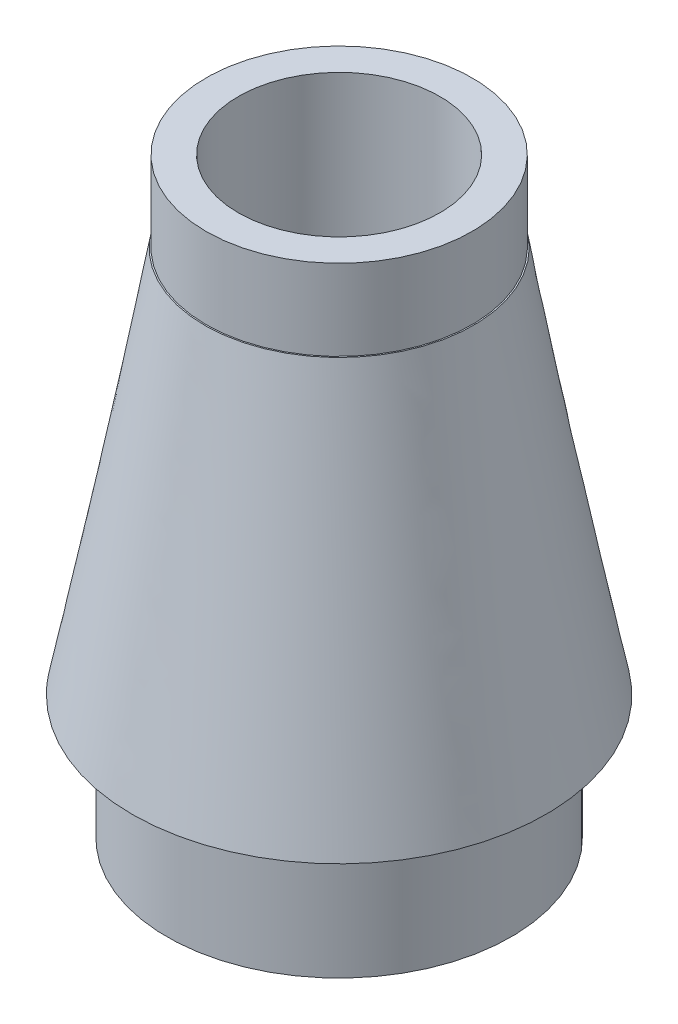
from build123d import *

# Parameters (mm, degrees)
BOSS_EXTRUDE1_REACH = 12.263
SKETCH4_R           = 2.475
BOSS_EXTRUDE2_REACH = 14.274
SKETCH1_R           = 3.2
CUT_EXTRUDE1_START  = -4
SKETCH5_R           = 2.475
CUT_EXTRUDE1_DEPTH  = 4
CUT_EXTRUDE2_REACH  = 14.274
SKETCH6_R           = 1.875


with BuildPart() as part:
    # Loft4: read off the stored shape, not the designer's step
    # Loft4: loft between two sections, ruled curve by curve
    loft4_from = [
        Edge.make_bspline([(3.50290491, 2.3, -1.597547242), (0.307810426, 2.3, -8.603357062), (-6.697999394, 2.3, -5.408262578), (-3.50290491, 2.3, 1.597547242), (-0.307810426, 2.3, 8.603357062), (6.697999394, 2.3, 5.408262578), (3.50290491, 2.3, -1.597547242)], [0, 0, 0, 0, 0.5, 0.5, 0.5, 1, 1, 1, 1], 3, [1, 0.333333333, 0.333333333, 1, 0.333333333, 0.333333333, 1]),
    ]
    loft4_to = [
        Edge.make_bspline([(2.465425341, 9.5, -0.414340307), (1.636744726, 9.5, -5.345190988), (-3.294105955, 9.5, -4.516510374), (-2.465425341, 9.5, 0.414340307), (-1.636744726, 9.5, 5.345190988), (3.294105955, 9.5, 4.516510374), (2.465425341, 9.5, -0.414340307)], [0, 0, 0, 0, 0.5, 0.5, 0.5, 1, 1, 1, 1], 3, [1, 0.333333333, 0.333333333, 1, 0.333333333, 0.333333333, 1]),
    ]
    loft4 = Solid(Shell([*[Face.make_surface_from_curves(loft4_from[k], loft4_to[k]) for k in range(1)], Face(Wire(loft4_from)), Face(Wire(loft4_to))]))
    add(loft4)

    # Sketch4 → Boss-Extrude1 (add, up to next)
    with BuildSketch(Plane(origin=(0, 11, 0), x_dir=(-1, 0, 0), z_dir=(0, 1, 0)), mode=Mode.PRIVATE) as boss_extrude1_sk1:
        with Locations(Location((0, 0, 0), (0, 0, 90))):
            Circle(SKETCH4_R)
    boss_extrude1_tool1 = extrude(boss_extrude1_sk1.sketch, amount=-BOSS_EXTRUDE1_REACH, mode=Mode.PRIVATE) - part.part
    add(boss_extrude1_tool1.solids().sort_by_distance((0, 11, 0))[0])

    # Sketch1 → Boss-Extrude2 (add, up to next)
    with BuildSketch(Plane(origin=(0, 0, 0), x_dir=(1, 0, 0), z_dir=(0, 1, 0)), mode=Mode.PRIVATE) as boss_extrude2_sk1:
        with Locations(Location((0, 0, 0), (0, 0, 90))):
            Circle(SKETCH1_R)
    boss_extrude2_tool1 = extrude(boss_extrude2_sk1.sketch, amount=BOSS_EXTRUDE2_REACH, mode=Mode.PRIVATE) - part.part
    add(boss_extrude2_tool1.solids().sort_by_distance((0, 0, 0))[0])

    # Sketch5 → Cut-Extrude1 (cut)
    with BuildSketch(Plane.XZ.offset(CUT_EXTRUDE1_START)):
        with Locations(Location((0, 0, 0), (0, 0, 90))):
            Circle(SKETCH5_R)
    extrude(amount=CUT_EXTRUDE1_DEPTH, mode=Mode.SUBTRACT)

    # Sketch6 → Cut-Extrude2 (cut, up to next)
    with BuildSketch(Plane(origin=(0, 11, 0), x_dir=(1, 0, 0), z_dir=(0, 1, 0)), mode=Mode.PRIVATE) as cut_extrude2_sk1:
        with Locations(Location((0, 0, 0), (0, 0, 270))):
            Circle(SKETCH6_R)
    cut_extrude2_tool1 = extrude(cut_extrude2_sk1.sketch, amount=-CUT_EXTRUDE2_REACH, mode=Mode.PRIVATE) & part.part
    add(cut_extrude2_tool1.solids().sort_by_distance((0, 11, 0))[0], mode=Mode.SUBTRACT)


solid = part.part
